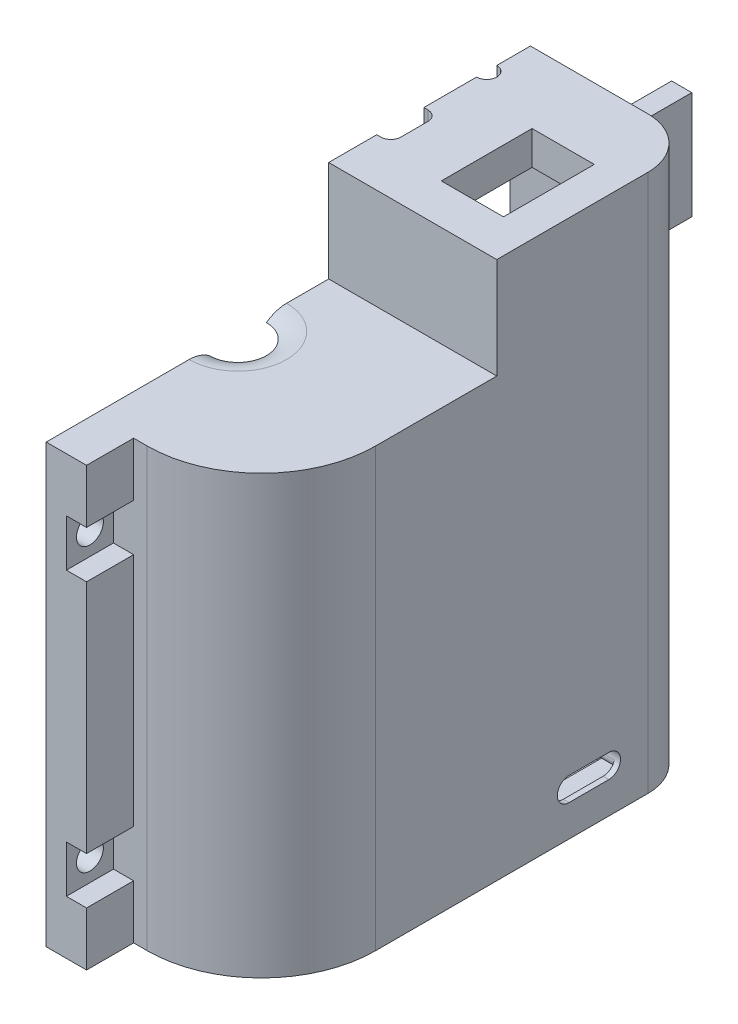
from build123d import *

# Parameters (mm, degrees)
FLOOR_2_DEPTH           = 3
WALLS_DEPTH             = 65
WALLS2_DEPTH            = 80
CEILING_START           = 60
CEILING_DEPTH           = 5
CEILING2_START          = 75
CEILING2_DEPTH          = 5
SALIENTE_EXTRUIR3_START = 80
SALIENTE_EXTRUIR3_DEPTH = 20
COVER_START             = 64
COVER_DEPTH             = 1
CROQUIS8_W              = 7
CROQUIS8_H              = 7.999999999999993
UNION_DEPTH             = 6
CROQUIS8_3_R            = 2.0000000000000036
CROQUIS8_3_R_2          = 2.0000000000000027
UNION_2_DEPTH           = 3
CONECTOR_START          = -32.5
CROQUIS9_W              = 17
CROQUIS9_H              = 15.999999999999993
CONECTOR_DEPTH          = 7
CONECTOR2_START         = -3
CONECTOR2_DEPTH         = 10
SWICHT_ESP_START        = 75
SWICHT_ESP_DEPTH        = 18.656624156074244
CORTAR_EXTRUIR2_DEPTH   = 93.65662415607424
CORTAR_EXTRUIR3_DEPTH   = 24.15
SALIENTE_EXTRUIR4_START = 3
SALIENTE_EXTRUIR4_DEPTH = 2.5
REDONDEO1_R             = 1
CROQUIS21_W             = 14.000000000000002
CROQUIS21_H             = 6.999999999999993
CORTAR_EXTRUIR5_DEPTH   = 90.22583706528059
REDONDEO2_R             = 5
CORTAR_EXTRUIR6_REACH   = 94.657
CROQUIS22_R             = 1.5000000000000018
REDONDEO3_R             = 1
CROQUIS18_W             = 20
CROQUIS18_H             = 16
CORTAR_EXTRUIR7_DEPTH   = 1.5


# Read off the part's stored shape, not the designer's step: Walls2
with BuildPart() as part:
    # Croquis3 → Floor 2 (new body)
    with BuildSketch(Plane(origin=(0, 0, 0), x_dir=(1, 0, 0), z_dir=(0, 1, 0))):
        with BuildLine():
            Line((17.5, 29.500000000000004), (0, 29.500000000000004))
            Line((0, 29.500000000000004), (7.41e-15, -29.500000000000004))
            Line((7.41e-15, -29.500000000000004), (8.000000000000002, -29.500000000000004))
            ThreePointArc((8.000000000000002, -29.500000000000007), (17.89949493661167, -25.399494936611667), (22.000000000000007, -15.499999999999998))
            Line((22.000000000000007, -15.5), (22.000000000000004, 25))
            ThreePointArc((22.000000000000004, 25), (20.681980515339465, 28.181980515339465), (17.5, 29.500000000000004))
        make_face()
    extrude(amount=FLOOR_2_DEPTH)

    # Croquis3<3> → Walls (add)
    with BuildSketch(Plane(origin=(0, 0, 0), x_dir=(1, 0, 0), z_dir=(0, 1, 0))):
        with BuildLine():
            Line((25.000000000000004, 5.5), (22.000000000000007, 5.5))
            Line((22.00000000000001, 5.5), (22.000000000000007, -15.5))
            ThreePointArc((22.000000000000007, -15.499999999999998), (17.89949493661167, -25.399494936611667), (8.000000000000002, -29.500000000000007))
            Line((8.000000000000002, -29.500000000000004), (7.41e-15, -29.500000000000004))
            Line((7.07e-15, -29.5), (7.41e-15, -32.5))
            Line((7.41e-15, -32.5), (8.000000000000005, -32.5))
            ThreePointArc((8.000000000000005, -32.5), (20.020815280171313, -27.520815280171306), (25, -15.499999999999998))
            Line((25, -15.499999999999998), (25.000000000000004, 5.500000000000002))
        make_face()
    extrude(amount=WALLS_DEPTH)

    # Walls2 outline → Walls2 (add)
    with BuildSketch(Plane(origin=(0, 0, 0), x_dir=(1, 0, 0), z_dir=(0, 1, 0))):
        with BuildLine():
            Line((0, 32.5), (0, 29.5))
            Line((0, 29.5), (17.5, 29.5))
            ThreePointArc((17.5, 29.5), (20.681980515, 28.181980515), (22, 25))
            Line((22, 25), (22, 2.5))
            Line((22, 2.5), (25, 2.5))
            Line((25, 2.5), (25, 25))
            ThreePointArc((25, 25), (22.803300859, 30.303300859), (17.5, 32.5))
            Line((17.5, 32.5), (0, 32.5))
        make_face()
    extrude(amount=WALLS2_DEPTH)

    # Croquis3<4> → Ceiling (add)
    with BuildSketch(Plane(origin=(0, 0, 0), x_dir=(1, 0, 0), z_dir=(0, 1, 0)).offset(CEILING_START)):
        with BuildLine():
            Line((22.000000000000007, 2.500000000000002), (3.55e-15, 2.4999999999999996))
            Line((3.42e-15, 2.5), (4.03e-15, -2.875000000000014))
            ThreePointArc((5.66e-15, -2.8750000000000107), (8.124999999999995, -11.00000000000001), (6.32e-15, -19.12500000000001))
            Line((5.89e-15, -19.125000000000014), (7.07e-15, -29.5))
            Line((7.41e-15, -29.500000000000004), (8.000000000000002, -29.500000000000004))
            ThreePointArc((8.000000000000002, -29.500000000000007), (17.89949493661167, -25.399494936611667), (22.000000000000007, -15.499999999999998))
            Line((22.000000000000007, -15.5), (22.000000000000007, 2.5000000000000036))
        make_face()
    extrude(amount=CEILING_DEPTH)

    # Croquis3<7> → Ceiling2 (add)
    with BuildSketch(Plane(origin=(0, 0, 0), x_dir=(1, 0, 0), z_dir=(0, 1, 0)).offset(CEILING2_START)):
        with BuildLine():
            Line((17.5, 29.500000000000004), (0, 29.500000000000004))
            Line((3.4e-16, 29.500000000000004), (3.08e-15, 5.5))
            Line((3.31e-15, 5.5), (22.000000000000007, 5.5))
            Line((22.000000000000004, 5.5), (22.000000000000004, 25))
            ThreePointArc((22.000000000000004, 25), (20.681980515339465, 28.181980515339465), (17.5, 29.500000000000004))
        make_face()
    extrude(amount=CEILING2_DEPTH)

    # Croquis3<8> → Saliente-Extruir3 (add)
    with BuildSketch(Plane(origin=(0, 0, 0), x_dir=(1, 0, 0), z_dir=(0, 1, 0)).offset(SALIENTE_EXTRUIR3_START)):
        Polygon((22.000000000000007, 5.5), (3.31e-15, 5.5), (3.42e-15, 2.5), (22.000000000000007, 2.500000000000002), align=None)
    extrude(amount=-SALIENTE_EXTRUIR3_DEPTH)

    # Croquis3<5> → Cover (add)
    with BuildSketch(Plane(origin=(0, 0, 0), x_dir=(1, 0, 0), z_dir=(0, 1, 0)).offset(COVER_START)):
        with BuildLine():
            ThreePointArc((6.32e-15, -19.12500000000001), (8.124999999999995, -11.00000000000001), (5.66e-15, -2.8750000000000107))
            Line((4.03e-15, -2.875000000000014), (4.48e-15, -6.750000000000014))
            ThreePointArc((5.44e-15, -6.750000000000012), (4.2499999999999964, -11.000000000000012), (5.85e-15, -15.250000000000012))
            Line((5.45e-15, -15.250000000000014), (5.89e-15, -19.125000000000014))
        make_face()
    extrude(amount=COVER_DEPTH)

    # Croquis8 → Union (add)
    with BuildSketch(Plane(origin=(0, 0, 0), x_dir=(0, 0, -1), z_dir=(1, 0, 0))):
        with Locations((-36, 61)):
            Rectangle(CROQUIS8_W, CROQUIS8_H)
        Polygon((-32.5, 15), (-32.5, 50), (-39.499999999999986, 50), (-39.49999999999999, 15), align=None)
        Polygon((-32.5, 0), (-32.5, 8), (-39.5, 8.000000000000002), (-39.49999999999999, 0), align=None)
        Polygon((39.5, 80), (32.5, 80), (32.5, 57.000000000000036), (39.49999999999999, 57.000000000000036), align=None)
        Polygon((39.49999999999999, 50.000000000000036), (32.500000000000014, 50.00000000000003), (32.5, 15), (39.49999999999999, 15), align=None)
    extrude(amount=UNION_DEPTH)

    # Croquis8<3> → Union_2 (add)
    # profile 1 of 4: a face of its own
    with BuildSketch(Plane(origin=(0, 0, 0), x_dir=(0, 0, -1), z_dir=(1, 0, 0))):
        Polygon((-32.5, 50), (-32.5, 57), (-39.49999999999998, 57), (-39.5, 50), align=None)
        with Locations((-35.99999999999999, 53.50000000000001)):
            Circle(CROQUIS8_3_R, mode=Mode.SUBTRACT)
    # profile 2 of 4: a face of its own
    with BuildSketch(Plane(origin=(0, 0, 0), x_dir=(0, 0, -1), z_dir=(1, 0, 0))):
        Polygon((-32.5, 8), (-32.5, 15), (-39.5, 15), (-39.49999999999999, 8), align=None)
        with Locations((-36.00000000000001, 11.5)):
            Circle(CROQUIS8_3_R_2, mode=Mode.SUBTRACT)
    # profile 3 of 4: a face of its own
    with BuildSketch(Plane(origin=(0, 0, 0), x_dir=(0, 0, -1), z_dir=(1, 0, 0))):
        Polygon((39.49999999999999, 15), (32.500000000000014, 15), (32.5, 0), (39.50000000000001, 0), align=None)
        with Locations((36.00000000000001, 11.5)):
            Circle(CROQUIS8_3_R_2, mode=Mode.SUBTRACT)
    # profile 4 of 4: a face of its own
    with BuildSketch(Plane(origin=(0, 0, 0), x_dir=(0, 0, -1), z_dir=(1, 0, 0))):
        Polygon((39.49999999999999, 57.000000000000036), (32.500000000000014, 57.000000000000036), (32.5, 50.00000000000003), (39.49999999999999, 50.000000000000036), align=None)
        with Locations((36.00000000000001, 53.500000000000036)):
            Circle(CROQUIS8_3_R, mode=Mode.SUBTRACT)
    extrude(amount=UNION_2_DEPTH)

    # Croquis9 → Conector (add)
    with BuildSketch(Plane.XY.offset(CONECTOR_START)):
        with Locations((8.5, 71)):
            Rectangle(CROQUIS9_W, CROQUIS9_H)
    extrude(amount=-CONECTOR_DEPTH)

    # Croquis12 → Conector2 (cut)
    with BuildSketch(Plane.XZ.offset(-63).offset(CONECTOR2_START)):
        Polygon((0, -32.50000000000001), (14, -32.50000000000001), (13.999999999999996, -34.50000000000001), (7.9999999999999964, -34.500000000000014), (7.538263617748875, -36.50000000000003), (13.499999999999998, -36.50000000000003), (13.499999999999998, -38.50000000000003), (12.845659041125556, -38.50000000000003), (12.61479085, -39.50000000000001), (0, -39.50000000000001), align=None)
    extrude(amount=-CONECTOR2_DEPTH, mode=Mode.SUBTRACT)

    # Croquis13 → Swicht-Esp (cut, through all)
    with BuildSketch(Plane(origin=(0, 0, 0), x_dir=(1, 0, 0), z_dir=(0, 1, 0)).offset(SWICHT_ESP_START)):
        with BuildLine():
            Line((-11.399999999999999, 9.650000000000002), (0.6000000000000015, 9.650000000000002))
            ThreePointArc((0.6000000000000015, 9.650000000000002), (1.6606601717798224, 10.089339828220183), (2.100000000000001, 11.150000000000004))
            Line((2.100000000000001, 11.150000000000004), (2.100000000000001, 15.150000000000004))
            ThreePointArc((2.100000000000001, 15.150000000000004), (1.6606601717798242, 16.210660171779825), (0.6000000000000015, 16.650000000000006))
            Line((0.6000000000000015, 16.650000000000006), (-11.399999999999999, 16.650000000000006))
            ThreePointArc((-11.399999999999999, 16.650000000000006), (-12.46066017177982, 16.210660171779825), (-12.899999999999999, 15.150000000000004))
            Line((-12.899999999999999, 15.150000000000004), (-12.899999999999999, 11.150000000000004))
            ThreePointArc((-12.899999999999999, 11.150000000000004), (-12.460660171779821, 10.089339828220181), (-11.399999999999999, 9.650000000000002))
        make_face()
        Polygon((20, 8.500000000000002), (10.75, 8.5), (10.75, 22.000000000000004), (20, 22.000000000000004), align=None)
    extrude(amount=SWICHT_ESP_DEPTH, mode=Mode.SUBTRACT)

    # Croquis19 → Cortar-Extruir2 (cut, through all)
    with BuildSketch(Plane(origin=(0, 0, 0), x_dir=(0, 0, -1), z_dir=(1, 0, 0))):
        with BuildLine():
            Line((13.250000000000005, 4.700000000000003), (19.150000000000006, 4.700000000000003))
            ThreePointArc((19.150000000000006, 4.700000000000003), (20.90000000000001, 6.450000000000006), (19.150000000000006, 8.20000000000001))
            Line((19.150000000000006, 8.20000000000001), (13.250000000000005, 8.20000000000001))
            ThreePointArc((13.250000000000005, 8.20000000000001), (11.500000000000002, 6.450000000000006), (13.250000000000005, 4.700000000000003))
        make_face()
    extrude(amount=CORTAR_EXTRUIR2_DEPTH, mode=Mode.SUBTRACT)

    # Croquis19<3> → Cortar-Extruir3 (cut)
    with BuildSketch(Plane(origin=(0, 0, 0), x_dir=(0, 0, -1), z_dir=(1, 0, 0))):
        Polygon((19.150000000000006, 4.700000000000003), (13.250000000000005, 4.700000000000003), (7.400000000000011, 4.700000000000003), (7.400000000000011, 3.0000000000000027), (25, 3.0000000000000027), (25, 4.700000000000003), align=None)
        Polygon((25, 3.0000000000000027), (25.500000000000004, 3.0000000000000053), (25.500000000000004, 4.700000000000003), (25, 4.700000000000003), align=None)
        Polygon((6.90000000000001, 3.0000000000000053), (6.90000000000001, 4.700000000000003), (7.400000000000011, 4.700000000000003), (7.400000000000011, 3.0000000000000027), align=None)
    extrude(amount=CORTAR_EXTRUIR3_DEPTH, mode=Mode.SUBTRACT)

    # Croquis20 → Saliente-Extruir4 (add)
    with BuildSketch(Plane(origin=(0, 0, 0), x_dir=(1, 0, 0), z_dir=(0, 1, 0)).offset(SALIENTE_EXTRUIR4_START)):
        Polygon((1.6500000000000026, 3.9500000000000064), (16.650000000000006, 3.950000000000008), (16.650000000000006, 7.450000000000009), (1.6500000000000026, 7.450000000000006), align=None)
        Polygon((1.6499999999999995, 28.450000000000003), (16.650000000000002, 28.450000000000003), (16.650000000000002, 24.950000000000003), (1.6500000000000004, 24.950000000000003), align=None)
    extrude(amount=SALIENTE_EXTRUIR4_DEPTH)

    # Redondeo1
    redondeo1_edges = [part.edges().sort_by_distance(p)[0] for p in [
        (1.6500000000000026, 3, -5.700000000000006),
        (9.150000000000004, 5.5, -3.9500000000000073),
        (16.650000000000006, 5.5, -5.700000000000008),
        (1.6500000000000026, 5.5, -5.700000000000006),
        (9.150000000000004, 5.5, -7.450000000000008),
        (9.150000000000004, 3, -3.9500000000000073),
        (9.150000000000002, 5.5, -24.950000000000003),
        (9.150000000000002, 3, -28.450000000000003),
        (1.65, 5.5, -26.700000000000003),
        (16.650000000000002, 5.5, -26.700000000000003),
        (9.150000000000002, 5.5, -28.450000000000003),
        (1.65, 3, -26.700000000000003),
    ]]
    fillet(redondeo1_edges, radius=REDONDEO1_R)

    # Croquis21 → Cortar-Extruir5 (cut, through all)
    with BuildSketch(Plane.XZ.offset(-76)):
        with Locations((7.000000000000001, -36)):
            Rectangle(CROQUIS21_W, CROQUIS21_H)
    extrude(amount=-CORTAR_EXTRUIR5_DEPTH, mode=Mode.SUBTRACT)

    # Redondeo2
    # the kernel refuses this fillet: 5 mm, written as the material it takes off along each edge
    with BuildSketch(Plane(origin=(-3.77e-15, 65, 11.000000000000012), x_dir=(-0.9999950652018581, 0, -0.0031415874858800956), z_dir=(-0.0031415874858800956, 0, 0.9999950652018581))) as redondeo2_piece_1:
        with BuildLine():
            CenterArc((7.250000000000317, 4.999999999999999), REDONDEO2_R, 233.13010235415305, 36.86989764584695)
            Line((4.250000000000113, 1.000000000000149), (4.190000000000109, 0.9200000000001578))
            ThreePointArc((4.190000000000109, 0.9200000000001578), (4.149999999999999, 0.5000000000000709), (4.150000000000007, 0))
            Line((4.150000000000007, 0), (4.250000000000007, -0.09999999999999429))
            Line((4.250000000000007, -0.09999999999999429), (7.250000000000317, -0.09999999999999429))
            Line((7.250000000000317, -0.09999999999999429), (7.250000000000317, 0))
        make_face()
    revolve(axis=Axis((-3.77e-15, 65, 11.000000000000012), (0, -1, 0)), revolution_arc=359.64, mode=Mode.SUBTRACT)

    # Croquis22 → Cortar-Extruir6 (cut, up to next)
    with BuildSketch(Plane(origin=(0, 80, 0), x_dir=(1, 0, 0), z_dir=(0, 1, 0)), mode=Mode.PRIVATE) as cortar_extruir6_sk1:
        with Locations((0, 26.00000000000001)):
            Circle(CROQUIS22_R)
    cortar_extruir6_tool1 = extrude(cortar_extruir6_sk1.sketch, amount=-CORTAR_EXTRUIR6_REACH, mode=Mode.PRIVATE) & part.part
    add(cortar_extruir6_tool1.solids().sort_by_distance((0, 80, -26))[0], mode=Mode.SUBTRACT)

    # Redondeo3
    redondeo3_edges = [part.edges().sort_by_distance(p)[0] for p in [
        (23.075000000000003, 4.700000000000003, -13.250000000000005),
        (23.075000000000006, 4.700000000000003, -19.150000000000006),
    ]]
    fillet(redondeo3_edges, radius=REDONDEO3_R)

    # Croquis18 → Cortar-Extruir7 (cut)
    with BuildSketch(Plane(origin=(0, 3, 0), x_dir=(1, 0, 0), z_dir=(0, 1, 0))):
        with Locations((10, 16)):
            Rectangle(CROQUIS18_W, CROQUIS18_H)
    extrude(amount=-CORTAR_EXTRUIR7_DEPTH, mode=Mode.SUBTRACT)


solid = part.part
